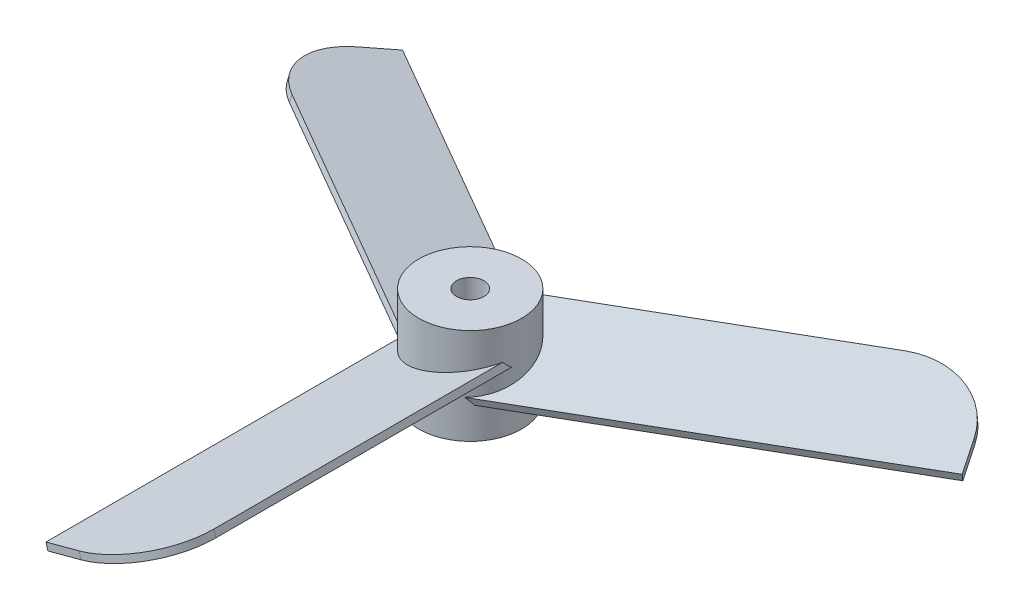
from build123d import *

# Parameters (mm, degrees)
SKETCH1_R                = 7.5
BOSS_EXTRUDE2_DEPTH      = 14
CUT_EXTRUDE1_REACH       = 19.564
SKETCH2_R                = 2
BOSS_EXTRUDE3_START      = -7.279118874
BOSS_EXTRUDE3_DEPTH      = 1.03527618
FILLET1_R                = 10
CIRPATTERN1_COUNT        = 3
FILLET1_OF_CIRPATTERN1_R = 10


with BuildPart() as part:
    # Sketch1 → Boss-Extrude2 (new body)
    with BuildSketch(Plane(origin=(0, 0, 0), x_dir=(1, 0, 0), z_dir=(0, 1, 0))):
        with Locations(Location((0, 0, 0), (0, 0, 270))):
            Circle(SKETCH1_R)
    extrude(amount=BOSS_EXTRUDE2_DEPTH)

    # Sketch2 → Cut-Extrude1 (cut, up to next)
    with BuildSketch(Plane(origin=(0, 14, 0), x_dir=(1, 0, 0), z_dir=(0, 1, 0)), mode=Mode.PRIVATE) as cut_extrude1_sk1:
        with Locations(Location((0, 0, 0), (0, 0, 270))):
            Circle(SKETCH2_R)
    cut_extrude1_tool1 = extrude(cut_extrude1_sk1.sketch, amount=-CUT_EXTRUDE1_REACH, mode=Mode.PRIVATE) & part.part
    add(cut_extrude1_tool1.solids().sort_by_distance((0, 14, 0))[0], mode=Mode.SUBTRACT)

    # Boss-Extrude3: read off the stored shape, not the designer's step
    # Boss-Extrude3 outline → Boss-Extrude3 (add)
    with BuildSketch(Plane(origin=(0, 0, 0), x_dir=(0.9659258262890672, 0.2588190451025251, 0), z_dir=(0.25881904510252507, -0.9659258262890672, 0)).offset(BOSS_EXTRUDE3_START)):
        with BuildLine():
            add(Edge.make_bspline(
                [(-5.688266684, 1.344969698), (-4.547659305, 7.389056985), (1.811733316, 7.498803292)],
                knots=[0.18030465, 0.18030465, 0.18030465, 1.551469461, 1.551469461, 1.551469461], degree=2, weights=[1, 0.771122328, 0.993637519]))
            add(Edge.make_bspline(
                [(1.811733316, 7.498803292), (8.171125936, 7.389056985), (9.311733316, 1.344969698)],
                knots=[1.590123193, 1.590123193, 1.590123193, 2.961288004, 2.961288004, 2.961288004], degree=2, weights=[0.993637519, 0.771122328, 1]))
            Line((9.311733316, 1.344969698), (9.311733316, 54.5))
            Line((9.311733316, 54.5), (-5.688266684, 54.5))
            Line((-5.688266684, 54.5), (-5.688266684, 1.344969698))
        make_face()
    boss_extrude3 = extrude(amount=BOSS_EXTRUDE3_DEPTH)

    # Fillet1
    fillet1_edges = [part.edges().sort_by_distance(p)[0] for p in [
        (7.244443697, 8.941142838, 54.5),
    ]]
    fillet(fillet1_edges, radius=FILLET1_R)

    # CirPattern1: Boss-Extrude3 ×3 about axis
    cirpattern1_axis = Axis((0, 0, 0), (0, 1, 0))
    for i in range(1, CIRPATTERN1_COUNT):
        add(boss_extrude3.rotate(cirpattern1_axis, i * 360 / CIRPATTERN1_COUNT))

    # Fillet1 of CirPattern1
    fillet1_of_cirpattern1_edges = [part.edges().sort_by_distance(p)[0] for p in [
        (43.576162658, 8.941142838, -33.523872278),
        (-50.820606355, 8.941142838, -20.976127722),
    ]]
    fillet(fillet1_of_cirpattern1_edges, radius=FILLET1_OF_CIRPATTERN1_R)


solid = part.part
